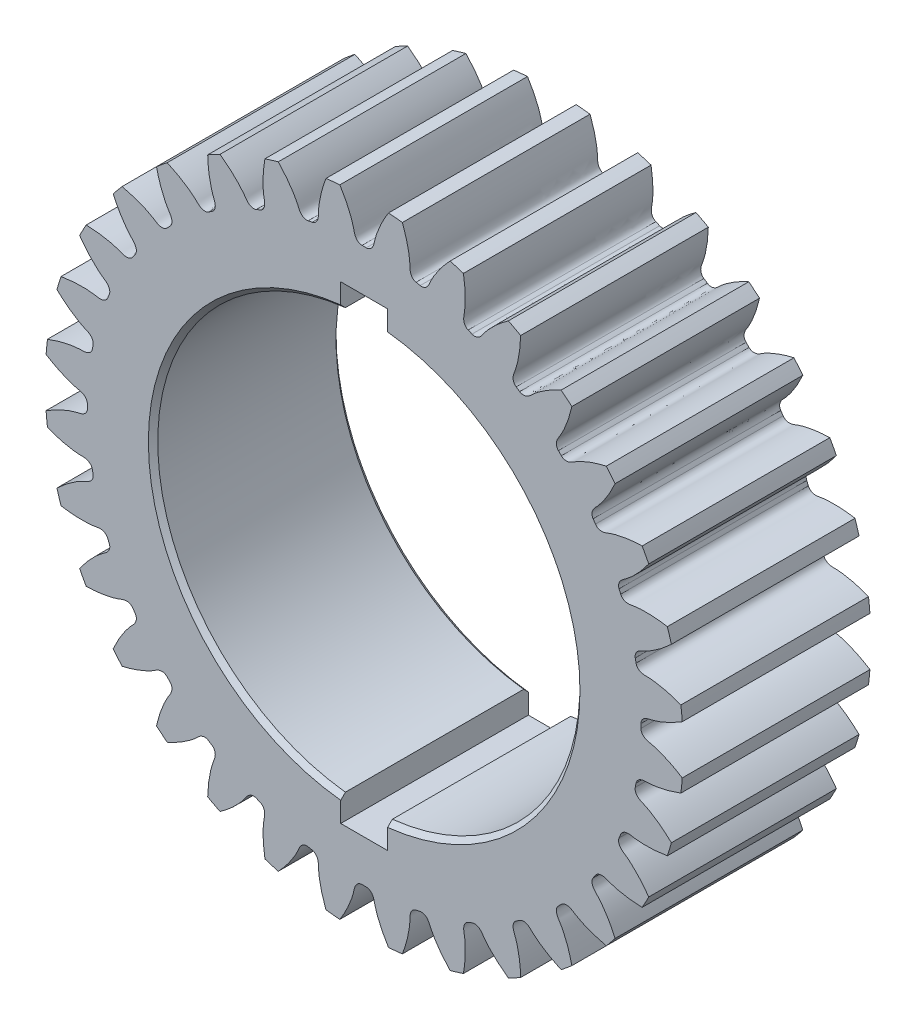
from build123d import *

# Parameters (mm, degrees)
GEAR_BASESKETCH_R                            = 34
F_2_0_64_0000MM_P_D_DEPTH                    = 10
TOOTH_CUT_START                              = -10
TOOTH_CUT_COARSE_PITCH_INVOLUTE_20_DEG_DEPTH = 20
PATTERN_CIRCULAR_1_COUNT                     = 32
SKETCH_3_R                                   = 22.5
CUT_EXTRUDE_2_DEPTH                          = 50
SKETCH_4_W                                   = 5
SKETCH_4_H                                   = 5.612292083
CUT_EXTRUDE_3_DEPTH                          = 50
PATTERN_CIRCULAR_2_COUNT                     = 2
CHAMFER_1_SIZE                               = 0.5


# Read off the part's stored shape, not the designer's step: Tooth-Cut, Coarse Pitch Involute 20 deg
with BuildPart() as part:
    # Gear-BaseSketch → 2.0 模数    , 64.0000mm P.D. (new, symmetric)
    with BuildSketch(Plane.XY):
        Circle(GEAR_BASESKETCH_R)
    extrude(amount=F_2_0_64_0000MM_P_D_DEPTH, both=True)

    # Tooth-Cut_ Coarse Pitch Involute 20  2 → Tooth-Cut, Coarse Pitch Involute 20 deg (cut)
    with BuildSketch(Plane.XY.offset(TOOTH_CUT_START)):
        with BuildLine():
            ThreePointArc((2.593141089, 33.900967822), (0, 34), (-2.593141089, 33.900967822))
            add(Edge.make_bspline(
                [(-2.593141089, 33.900967822), (-2.519304949, 33.782789026), (-2.359069101, 33.524214371), (-2.133039591, 33.126355644), (-1.918666842, 32.719524906), (-1.733599921, 32.336820473), (-1.575647019, 31.979890715), (-1.442888123, 31.650062498), (-1.333284364, 31.348604637), (-1.244687628, 31.076680888), (-1.175122451, 30.835300617), (-1.121876131, 30.625503551), (-1.091970996, 30.484292862), (-1.073546618, 30.393449493), (-1.062261477, 30.342412611), (-1.04276938, 30.264917812), (-1.014677962, 30.17095216), (-0.973513089, 30.061562394), (-0.922920118, 29.954774047), (-0.858928055, 29.848795159), (-0.774849017, 29.742587723), (-0.660676271, 29.638521684), (-0.506159807, 29.548229935), (-0.351460246, 29.505098488), (-0.252678045, 29.50057341), (-0.221935793, 29.499165149)],
                knots=[0.021018146, 0.021018146, 0.021018146, 0.021018146, 0.099946283, 0.193327327, 0.280143133, 0.3603937, 0.434079029, 0.501199119, 0.561753971, 0.615743585, 0.66316796, 0.704027097, 0.738320996, 0.74491869, 0.756533941, 0.767925247, 0.790178657, 0.812048987, 0.834070568, 0.857024732, 0.882030924, 0.910555086, 0.944025315, 0.982579981, 1, 1, 1, 1], degree=3))
            ThreePointArc((-0.221935793, 29.499165149), (0, 29.5), (0.221935793, 29.499165149))
            add(Edge.make_bspline(
                [(0.221935793, 29.499165149), (0.252678045, 29.50057341), (0.351460246, 29.505098488), (0.506159807, 29.548229935), (0.660676271, 29.638521684), (0.774849017, 29.742587723), (0.858928055, 29.848795159), (0.922920118, 29.954774047), (0.973513089, 30.061562394), (1.014677962, 30.17095216), (1.04276938, 30.264917812), (1.062261477, 30.342412611), (1.073546618, 30.393449493), (1.091970996, 30.484292862), (1.121876131, 30.625503551), (1.175122451, 30.835300617), (1.244687628, 31.076680888), (1.333284364, 31.348604637), (1.442888123, 31.650062498), (1.575647019, 31.979890715), (1.733599921, 32.336820473), (1.918666842, 32.719524906), (2.133039591, 33.126355644), (2.359069101, 33.524214371), (2.519304949, 33.782789026), (2.593141089, 33.900967822)],
                knots=[0, 0, 0, 0, 0.017420019, 0.055974685, 0.089444914, 0.117969076, 0.142975268, 0.165929432, 0.187951013, 0.209821343, 0.232074753, 0.243466059, 0.25508131, 0.261679004, 0.295972903, 0.33683204, 0.384256415, 0.438246029, 0.498800881, 0.565920971, 0.6396063, 0.719856867, 0.806672673, 0.900053717, 0.978981854, 0.978981854, 0.978981854, 0.978981854], degree=3))
        make_face()
    tooth_cut_coarse_pitch_involute_20_deg = extrude(amount=TOOTH_CUT_COARSE_PITCH_INVOLUTE_20_DEG_DEPTH, mode=Mode.SUBTRACT)

    # 阵列(圆周)1: Tooth-Cut, Coarse Pitch Involute 20 deg ×32 about axis
    pattern_circular_1_axis = Axis((0, 0, -88.99), (0, 0, 1))
    for i in range(1, PATTERN_CIRCULAR_1_COUNT):
        add(tooth_cut_coarse_pitch_involute_20_deg.rotate(pattern_circular_1_axis, i * 360 / PATTERN_CIRCULAR_1_COUNT), mode=Mode.SUBTRACT)

    # 草图3 → 切除-拉伸2 (cut)
    with BuildSketch(Plane.XY.offset(10)):
        Circle(SKETCH_3_R)
    extrude(amount=-CUT_EXTRUDE_2_DEPTH, mode=Mode.SUBTRACT)

    # 草图4 → 切除-拉伸3 (cut)
    with BuildSketch(Plane.XY.offset(10)):
        with Locations((0, 22.193853959)):
            Rectangle(SKETCH_4_W, SKETCH_4_H)
    cut_extrude_3 = extrude(amount=-CUT_EXTRUDE_3_DEPTH, mode=Mode.SUBTRACT)

    # 阵列(圆周)2: 切除-拉伸3 ×2 about axis
    pattern_circular_2_axis = Axis((0, 0, 0), (0, 0, 1))
    for i in range(1, PATTERN_CIRCULAR_2_COUNT):
        add(cut_extrude_3.rotate(pattern_circular_2_axis, i * 360 / PATTERN_CIRCULAR_2_COUNT), mode=Mode.SUBTRACT)

    # 倒角1
    chamfer_1_edges = [part.edges().sort_by_distance(p)[0] for p in [
        (-22.5, 0, 10),
        (-22.5, 0, -10),
        (22.5, 0, -10),
        (22.5, 0, 10),
    ]]
    chamfer(chamfer_1_edges, length=CHAMFER_1_SIZE)


solid = part.part
